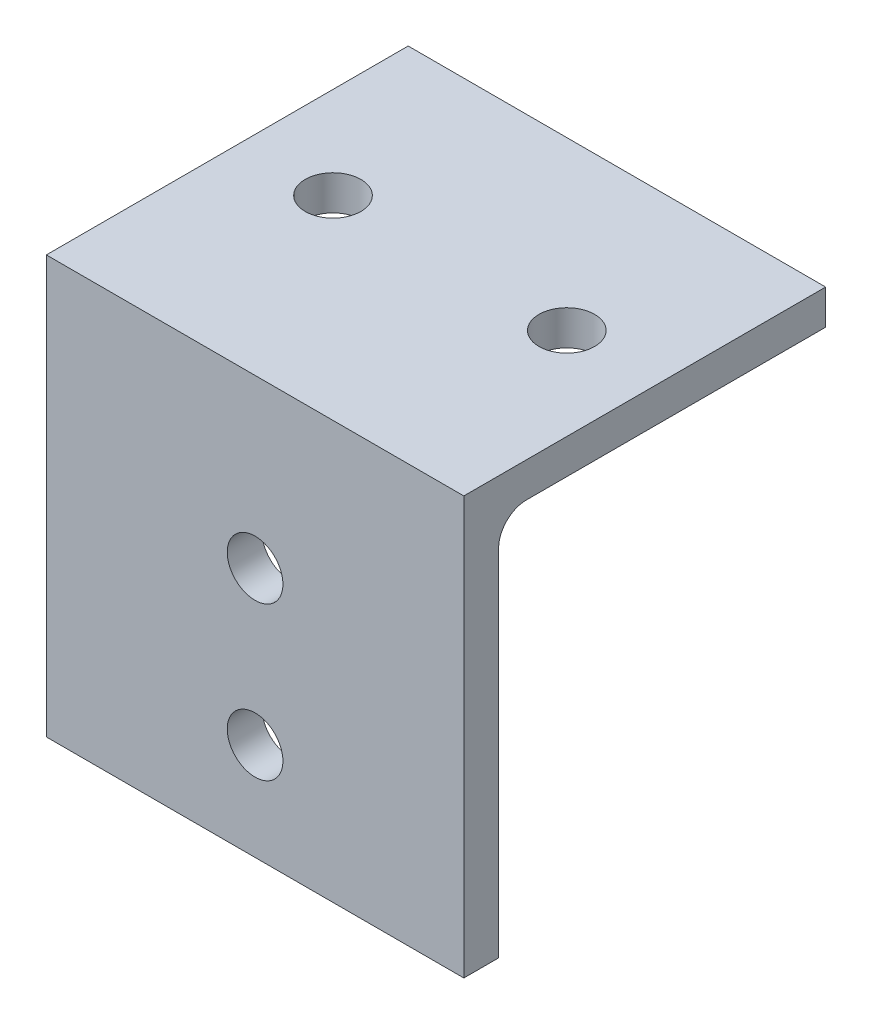
from build123d import *

# Parameters (mm, degrees)
SKETCH1_R           = 2.54
BOSS_EXTRUDE1_DEPTH = 3.175
SKETCH2_W           = 38.1
SKETCH2_H           = 38.1
SKETCH2_R           = 2.54
BOSS_EXTRUDE2_DEPTH = 3.175
FILLET2_R           = 2.54


with BuildPart() as part:
    # Sketch1 → Boss-Extrude1 (new body)
    with BuildSketch(Plane(origin=(0, 0, 0), x_dir=(1, 0, 0), z_dir=(0, 1, 0))):
        Polygon((-19.583364039, 16.770768135), (-5.08, 16.770768135), (5.08, 16.770768135), (18.516635961, 16.770768135), (18.516635961, -13.074231865), (-19.583364039, -13.074231865), align=None)
        with Locations((-11.201364039, 1.530768135)):
            Circle(SKETCH1_R, mode=Mode.SUBTRACT)
        with Locations((10.134635961, 1.530768135)):
            Circle(SKETCH1_R, mode=Mode.SUBTRACT)
    extrude(amount=BOSS_EXTRUDE1_DEPTH)

    # Sketch2 → Boss-Extrude2 (add)
    with BuildSketch(Plane.XY.offset(13.074231865)):
        with Locations((-0.533364039, -15.875)):
            Rectangle(SKETCH2_W, SKETCH2_H)
        with Locations((-0.533364039, -12.065)):
            Circle(SKETCH2_R, mode=Mode.SUBTRACT)
        with Locations((-0.533364039, -26.035)):
            Circle(SKETCH2_R, mode=Mode.SUBTRACT)
    extrude(amount=BOSS_EXTRUDE2_DEPTH)

    # Fillet2
    fillet2_edges = [part.edges().sort_by_distance(p)[0] for p in [
        (-0.533364039, 0, 13.074231865),
    ]]
    fillet(fillet2_edges, radius=FILLET2_R)


solid = part.part
